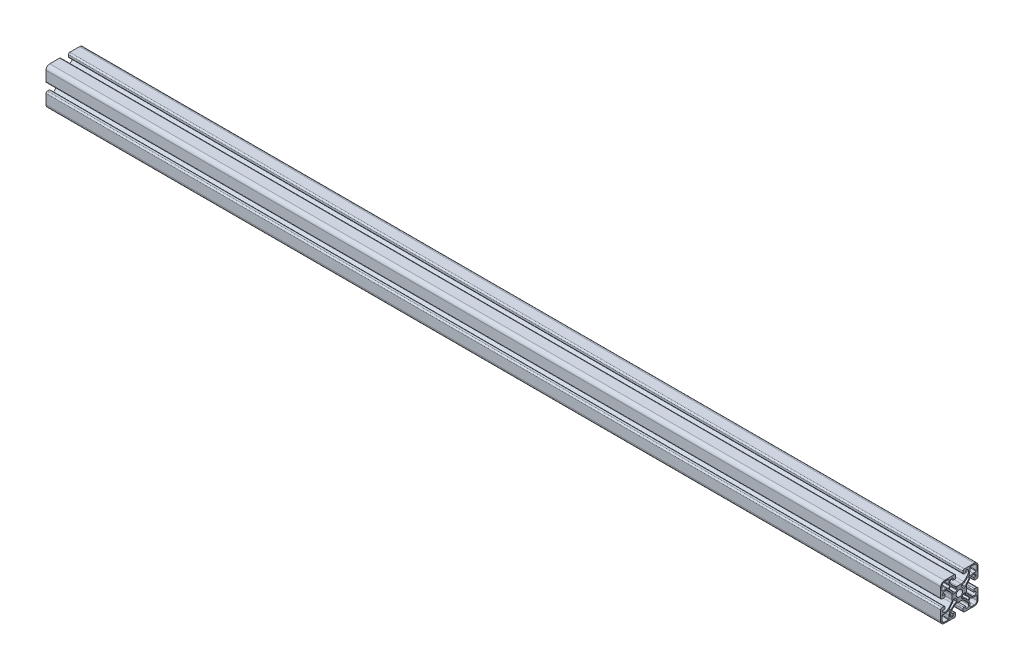
from build123d import *

# Parameters (mm, degrees)
SKETCH1_R           = 2.159
BOSS_EXTRUDE1_DEPTH = 609.6


with BuildPart() as part:
    # Sketch1 → Boss-Extrude1 (new body)
    with BuildSketch(Plane.YZ):
        with BuildLine():
            Line((0.772520695, -13.711151156), (0.772520695, -14.981151156))
            ThreePointArc((0.772520695, -14.981151156), (0.493539904, -15.654670365), (-0.179979305, -15.933651156))
            Line((-0.179979305, -15.933651156), (-6.847479304, -15.933651156))
            ThreePointArc((-6.847479304, -15.933651156), (-8.643530528, -15.18970238), (-9.387479304, -13.393651156))
            Line((-9.387479304, -13.393651156), (-9.387479304, -6.726151156))
            ThreePointArc((-9.387479304, -6.726151156), (-9.108498513, -6.052631947), (-8.434979304, -5.773651156))
            Line((-8.434979304, -5.773651156), (-7.164979304, -5.773651156))
            ThreePointArc((-7.164979304, -5.773651156), (-6.715966498, -5.95963835), (-6.529979304, -6.408651156))
            Line((-6.529979304, -6.408651156), (-6.529979304, -7.519901156))
            ThreePointArc((-6.529979304, -7.519901156), (-6.576476103, -7.632154358), (-6.688729304, -7.678651156))
            Line((-6.688729304, -7.678651156), (-7.958729304, -7.678651156))
            ThreePointArc((-7.958729304, -7.678651156), (-8.070982506, -7.725147955), (-8.117479304, -7.837401156))
            Line((-8.117479304, -7.837401156), (-8.117479304, -7.996151156))
            ThreePointArc((-8.117479304, -7.996151156), (-7.652511319, -9.118683171), (-6.529979304, -9.583651156))
            Line((-6.529979304, -9.583651156), (-6.034908058, -9.583651156))
            ThreePointArc((-6.034908058, -9.583651156), (-5.630688087, -9.517605564), (-5.268510552, -9.326338111))
            ThreePointArc((-5.268510552, -9.326338111), (-3.576591903, -7.846310071), (-2.110681684, -6.142144896))
            ThreePointArc((-2.110681684, -6.142144896), (-1.737480566, -5.424665046), (-1.608729304, -4.626241899))
            Line((-1.608729304, -4.626241899), (-1.608729304, -1.84106041))
            ThreePointArc((-1.608729304, -1.84106041), (-1.737480566, -1.042637264), (-2.110681683, -0.325157416))
            ThreePointArc((-2.110681683, -0.325157416), (-3.576591906, 1.379007761), (-5.268510559, 2.859035802))
            ThreePointArc((-5.268510559, 2.859035802), (-5.630688091, 3.050303253), (-6.034908058, 3.116348845))
            Line((-6.034908058, 3.116348845), (-6.529979305, 3.116348845))
            ThreePointArc((-6.529979305, 3.116348845), (-7.65251132, 2.65138086), (-8.117479305, 1.528848845))
            Line((-8.117479305, 1.528848845), (-8.117479305, 1.370098845))
            ThreePointArc((-8.117479305, 1.370098845), (-8.070982507, 1.257845643), (-7.958729305, 1.211348845))
            Line((-7.958729305, 1.211348845), (-6.688729305, 1.211348845))
            ThreePointArc((-6.688729305, 1.211348845), (-6.576476104, 1.164852046), (-6.529979305, 1.052598845))
            Line((-6.529979305, 1.052598845), (-6.529979305, -0.058651155))
            ThreePointArc((-6.529979305, -0.058651155), (-6.715966499, -0.507663961), (-7.164979305, -0.693651155))
            Line((-7.164979305, -0.693651155), (-8.434979305, -0.693651155))
            ThreePointArc((-8.434979305, -0.693651155), (-9.108498514, -0.414670364), (-9.387479305, 0.258848845))
            Line((-9.387479305, 0.258848845), (-9.387479305, 6.926348844))
            ThreePointArc((-9.387479305, 6.926348844), (-8.643530529, 8.722400069), (-6.847479305, 9.466348844))
            Line((-6.847479305, 9.466348844), (-0.179979306, 9.466348844))
            ThreePointArc((-0.179979306, 9.466348844), (0.493539903, 9.187368053), (0.772520694, 8.513848844))
            Line((0.772520694, 8.513848844), (0.772520694, 7.243848844))
            ThreePointArc((0.772520694, 7.243848844), (0.5865335, 6.794836038), (0.137520694, 6.608848844))
            Line((0.137520694, 6.608848844), (-0.973729306, 6.608848844))
            ThreePointArc((-0.973729306, 6.608848844), (-1.085982507, 6.655345643), (-1.132479306, 6.767598844))
            Line((-1.132479306, 6.767598844), (-1.132479306, 8.037598844))
            ThreePointArc((-1.132479306, 8.037598844), (-1.178976104, 8.149852046), (-1.291229306, 8.196348844))
            Line((-1.291229306, 8.196348844), (-1.449979306, 8.196348844))
            ThreePointArc((-1.449979306, 8.196348844), (-2.572511321, 7.73138086), (-3.037479306, 6.608848844))
            Line((-3.037479306, 6.608848844), (-3.037479306, 6.113777598))
            ThreePointArc((-3.037479306, 6.113777598), (-2.971433714, 5.709557627), (-2.780166261, 5.347380093))
            ThreePointArc((-2.780166261, 5.347380093), (-1.30013822, 3.655461444), (0.404026955, 2.189551224))
            ThreePointArc((0.404026955, 2.189551224), (1.121506805, 1.816350106), (1.919929952, 1.687598845))
            Line((1.919929952, 1.687598845), (4.705111441, 1.687598845))
            ThreePointArc((4.705111441, 1.687598845), (5.503534586, 1.816350106), (6.221014435, 2.189551223))
            ThreePointArc((6.221014435, 2.189551223), (7.925179612, 3.655461446), (9.405207653, 5.3473801))
            ThreePointArc((9.405207653, 5.3473801), (9.596475104, 5.709557631), (9.662520695, 6.113777598))
            Line((9.662520695, 6.113777598), (9.662520695, 6.608848846))
            ThreePointArc((9.662520695, 6.608848846), (9.197552711, 7.731380861), (8.075020695, 8.196348846))
            Line((8.075020695, 8.196348846), (7.916270695, 8.196348846))
            ThreePointArc((7.916270695, 8.196348846), (7.804017494, 8.149852047), (7.757520695, 8.037598846))
            Line((7.757520695, 8.037598846), (7.757520695, 6.767598846))
            ThreePointArc((7.757520695, 6.767598846), (7.711023897, 6.655345644), (7.598770695, 6.608848846))
            Line((7.598770695, 6.608848846), (6.487520696, 6.608848846))
            ThreePointArc((6.487520696, 6.608848846), (6.03850789, 6.79483604), (5.852520696, 7.243848846))
            Line((5.852520696, 7.243848846), (5.852520696, 8.513848846))
            ThreePointArc((5.852520696, 8.513848846), (6.131501487, 9.187368055), (6.805020696, 9.466348846))
            Line((6.805020696, 9.466348846), (13.472520695, 9.466348846))
            ThreePointArc((13.472520695, 9.466348846), (15.268571919, 8.72240007), (16.012520695, 6.926348846))
            Line((16.012520695, 6.926348846), (16.012520695, 0.258848846))
            ThreePointArc((16.012520695, 0.258848846), (15.733539904, -0.414670363), (15.060020695, -0.693651154))
            Line((15.060020695, -0.693651154), (13.790020695, -0.693651154))
            ThreePointArc((13.790020695, -0.693651154), (13.341007889, -0.50766396), (13.155020695, -0.058651154))
            Line((13.155020695, -0.058651154), (13.155020695, 1.052598846))
            ThreePointArc((13.155020695, 1.052598846), (13.201517494, 1.164852048), (13.313770695, 1.211348846))
            Line((13.313770695, 1.211348846), (14.583770695, 1.211348846))
            ThreePointArc((14.583770695, 1.211348846), (14.696023897, 1.257845645), (14.742520695, 1.370098846))
            Line((14.742520695, 1.370098846), (14.742520695, 1.528848846))
            ThreePointArc((14.742520695, 1.528848846), (14.27755271, 2.651380861), (13.155020695, 3.116348846))
            Line((13.155020695, 3.116348846), (12.659949449, 3.116348846))
            ThreePointArc((12.659949449, 3.116348846), (12.255729478, 3.050303254), (11.893551943, 2.859035801))
            ThreePointArc((11.893551943, 2.859035801), (10.201633294, 1.37900776), (8.735723075, -0.325157415))
            ThreePointArc((8.735723075, -0.325157415), (8.362521957, -1.042637264), (8.233770695, -1.841060411))
            Line((8.233770695, -1.841060411), (8.233770695, -4.626241901))
            ThreePointArc((8.233770695, -4.626241901), (8.362521957, -5.424665046), (8.735723074, -6.142144894))
            ThreePointArc((8.735723074, -6.142144894), (10.201633297, -7.846310072), (11.89355195, -9.326338113))
            ThreePointArc((11.89355195, -9.326338113), (12.255729482, -9.517605564), (12.659949449, -9.583651155))
            Line((12.659949449, -9.583651155), (13.155020696, -9.583651155))
            ThreePointArc((13.155020696, -9.583651155), (14.277552711, -9.11868317), (14.742520696, -7.996151155))
            Line((14.742520696, -7.996151155), (14.742520696, -7.837401155))
            ThreePointArc((14.742520696, -7.837401155), (14.696023898, -7.725147954), (14.583770696, -7.678651155))
            Line((14.583770696, -7.678651155), (13.313770696, -7.678651155))
            ThreePointArc((13.313770696, -7.678651155), (13.201517495, -7.632154357), (13.155020696, -7.519901155))
            Line((13.155020696, -7.519901155), (13.155020696, -6.408651155))
            ThreePointArc((13.155020696, -6.408651155), (13.34100789, -5.959638349), (13.790020696, -5.773651155))
            Line((13.790020696, -5.773651155), (15.060020696, -5.773651155))
            ThreePointArc((15.060020696, -5.773651155), (15.733539905, -6.052631946), (16.012520696, -6.726151155))
            Line((16.012520696, -6.726151155), (16.012520696, -13.393651155))
            ThreePointArc((16.012520696, -13.393651155), (15.26857192, -15.189702379), (13.472520696, -15.933651155))
            Line((13.472520696, -15.933651155), (6.805020697, -15.933651155))
            ThreePointArc((6.805020697, -15.933651155), (6.131501488, -15.654670364), (5.852520697, -14.981151155))
            Line((5.852520697, -14.981151155), (5.852520697, -13.711151155))
            ThreePointArc((5.852520697, -13.711151155), (6.038507891, -13.262138349), (6.487520697, -13.076151155))
            Line((6.487520697, -13.076151155), (7.598770697, -13.076151155))
            ThreePointArc((7.598770697, -13.076151155), (7.711023898, -13.122647953), (7.757520697, -13.234901155))
            Line((7.757520697, -13.234901155), (7.757520697, -14.504901155))
            ThreePointArc((7.757520697, -14.504901155), (7.804017495, -14.617154356), (7.916270697, -14.663651155))
            Line((7.916270697, -14.663651155), (8.075020697, -14.663651155))
            ThreePointArc((8.075020697, -14.663651155), (9.197552712, -14.19868317), (9.662520697, -13.076151155))
            Line((9.662520697, -13.076151155), (9.662520697, -12.581079908))
            ThreePointArc((9.662520697, -12.581079908), (9.596475104, -12.176859938), (9.405207651, -11.814682403))
            ThreePointArc((9.405207651, -11.814682403), (7.925179611, -10.122763754), (6.221014436, -8.656853534))
            ThreePointArc((6.221014436, -8.656853534), (5.503534586, -8.283652417), (4.705111439, -8.154901155))
            Line((4.705111439, -8.154901155), (1.91992995, -8.154901155))
            ThreePointArc((1.91992995, -8.154901155), (1.121506805, -8.283652417), (0.404026956, -8.656853534))
            ThreePointArc((0.404026956, -8.656853534), (-1.300138221, -10.122763756), (-2.780166262, -11.81468241))
            ThreePointArc((-2.780166262, -11.81468241), (-2.971433713, -12.176859941), (-3.037479304, -12.581079908))
            Line((-3.037479304, -12.581079908), (-3.037479304, -13.076151156))
            ThreePointArc((-3.037479304, -13.076151156), (-2.57251132, -14.198683171), (-1.449979305, -14.663651156))
            Line((-1.449979305, -14.663651156), (-1.291229305, -14.663651156))
            ThreePointArc((-1.291229305, -14.663651156), (-1.178976103, -14.617154357), (-1.132479305, -14.504901156))
            Line((-1.132479305, -14.504901156), (-1.132479305, -13.234901156))
            ThreePointArc((-1.132479305, -13.234901156), (-1.085982506, -13.122647954), (-0.973729305, -13.076151156))
            Line((-0.973729305, -13.076151156), (0.137520695, -13.076151156))
            ThreePointArc((0.137520695, -13.076151156), (0.586533501, -13.26213835), (0.772520695, -13.711151156))
        make_face()
        with Locations((3.312520697, -3.233651155)):
            Circle(SKETCH1_R, mode=Mode.SUBTRACT)
        with BuildLine():
            Line((9.84481504, 4.637844283), (10.012608151, 4.8557916))
            ThreePointArc((10.012608151, 4.8557916), (10.318636081, 5.435275655), (10.42430903, 6.082027611))
            Line((10.42430903, 6.082027611), (10.42430903, 8.386848856))
            ThreePointArc((10.42430903, 8.386848856), (10.517302627, 8.611355259), (10.74180903, 8.704348856))
            Line((10.74180903, 8.704348856), (13.472309014, 8.704348856))
            ThreePointArc((13.472309014, 8.704348856), (14.729544877, 8.183584711), (15.250309023, 6.926348847))
            Line((15.250309023, 6.926348847), (15.250309023, 4.19584885))
            ThreePointArc((15.250309023, 4.19584885), (15.157315426, 3.971342447), (14.932809023, 3.87834885))
            Line((14.932809023, 3.87834885), (12.627987776, 3.87834885))
            ThreePointArc((12.627987776, 3.87834885), (11.981235825, 3.772675903), (11.401751773, 3.466647978))
            Line((11.401751773, 3.466647978), (11.183804456, 3.298854867))
            ThreePointArc((11.183804456, 3.298854867), (10.968844184, 3.23190561), (10.763539377, 3.324318043))
            Line((10.763539377, 3.324318043), (9.870278216, 4.217579204))
            ThreePointArc((9.870278216, 4.217579204), (9.777865783, 4.422884011), (9.84481504, 4.637844283))
        make_face(mode=Mode.SUBTRACT)
        with BuildLine():
            Line((-4.558974742, 3.298643188), (-4.776922058, 3.466436299))
            ThreePointArc((-4.776922058, 3.466436299), (-5.35640611, 3.772464224), (-6.003158061, 3.878137171))
            Line((-6.003158061, 3.878137171), (-8.307979315, 3.878137171))
            ThreePointArc((-8.307979315, 3.878137171), (-8.532485718, 3.971130768), (-8.625479315, 4.195637171))
            Line((-8.625479315, 4.195637171), (-8.625479315, 6.926137161))
            ThreePointArc((-8.625479315, 6.926137161), (-8.104715169, 8.183373025), (-6.847479306, 8.704137171))
            Line((-6.847479306, 8.704137171), (-4.116979309, 8.704137171))
            ThreePointArc((-4.116979309, 8.704137171), (-3.892472906, 8.611143574), (-3.799479309, 8.386637171))
            Line((-3.799479309, 8.386637171), (-3.799479309, 6.081815924))
            ThreePointArc((-3.799479309, 6.081815924), (-3.693806362, 5.435063973), (-3.387778437, 4.85557992))
            Line((-3.387778437, 4.85557992), (-3.219985326, 4.637632604))
            ThreePointArc((-3.219985326, 4.637632604), (-3.153036069, 4.422672332), (-3.245448502, 4.217367525))
            Line((-3.245448502, 4.217367525), (-4.138709663, 3.324106364))
            ThreePointArc((-4.138709663, 3.324106364), (-4.34401447, 3.231693931), (-4.558974742, 3.298643188))
        make_face(mode=Mode.SUBTRACT)
        with BuildLine():
            Line((4.900020697, -0.306445792), (4.900020697, 0.638730742))
            ThreePointArc((4.900020697, 0.638730742), (4.978885643, 0.848157487), (5.176301398, 0.953543734))
            ThreePointArc((5.176301398, 0.953543734), (5.993365908, 1.169605569), (6.728820708, 1.585998853))
            ThreePointArc((6.728820708, 1.585998853), (7.886169011, 2.538405301), (8.953104421, 3.591107524))
            ThreePointArc((8.953104421, 3.591107524), (9.179965542, 3.692814602), (9.41055899, 3.599879359))
            Line((9.41055899, 3.599879359), (10.146051215, 2.864387135))
            ThreePointArc((10.146051215, 2.864387135), (10.238986457, 2.633793689), (10.137279379, 2.406932571))
            ThreePointArc((10.137279379, 2.406932571), (9.084577143, 1.339997151), (8.132170687, 0.182648832))
            ThreePointArc((8.132170687, 0.182648832), (7.715777415, -0.552805957), (7.499715586, -1.369870454))
            ThreePointArc((7.499715586, -1.369870454), (7.39432934, -1.567286209), (7.184902595, -1.646151156))
            Line((7.184902595, -1.646151156), (6.23972607, -1.646151156))
            ThreePointArc((6.23972607, -1.646151156), (6.08836388, -1.607749235), (5.973616485, -1.501832971))
            ThreePointArc((5.973616485, -1.501832971), (5.557584726, -0.98858712), (5.044338875, -0.572555363))
            ThreePointArc((5.044338875, -0.572555363), (4.938422615, -0.457807974), (4.900020697, -0.306445792))
        make_face(mode=Mode.SUBTRACT)
        with BuildLine():
            Line((0.385315334, -1.646151156), (-0.559861201, -1.646151156))
            ThreePointArc((-0.559861201, -1.646151156), (-0.769287945, -1.567286209), (-0.874674192, -1.369870455))
            ThreePointArc((-0.874674192, -1.369870455), (-1.090736028, -0.552805945), (-1.507129311, 0.182648856))
            ThreePointArc((-1.507129311, 0.182648856), (-2.459535759, 1.339997159), (-3.512237982, 2.406932568))
            ThreePointArc((-3.512237982, 2.406932568), (-3.61394506, 2.633793689), (-3.521009818, 2.864387138))
            Line((-3.521009818, 2.864387138), (-2.785517593, 3.599879363))
            ThreePointArc((-2.785517593, 3.599879363), (-2.554924147, 3.692814604), (-2.328063029, 3.591107527))
            ThreePointArc((-2.328063029, 3.591107527), (-1.26112761, 2.538405291), (-0.103779291, 1.585998835))
            ThreePointArc((-0.103779291, 1.585998835), (0.631675499, 1.169605562), (1.448739995, 0.953543734))
            ThreePointArc((1.448739995, 0.953543734), (1.64615575, 0.848157487), (1.725020697, 0.638730743))
            Line((1.725020697, 0.638730743), (1.725020697, -0.306445783))
            ThreePointArc((1.725020697, -0.306445783), (1.686618777, -0.457807972), (1.580702512, -0.572555367))
            ThreePointArc((1.580702512, -0.572555367), (1.067456662, -0.988587126), (0.651424905, -1.501832978))
            ThreePointArc((0.651424905, -1.501832978), (0.536677515, -1.607749237), (0.385315334, -1.646151156))
        make_face(mode=Mode.SUBTRACT)
        with BuildLine():
            Line((-3.219773646, -11.105146594), (-3.387566758, -11.32309391))
            ThreePointArc((-3.387566758, -11.32309391), (-3.693594682, -11.902577963), (-3.79926763, -12.549329913))
            Line((-3.79926763, -12.549329913), (-3.79926763, -14.854151161))
            ThreePointArc((-3.79926763, -14.854151161), (-3.892261226, -15.078657564), (-4.116767629, -15.171651161))
            Line((-4.116767629, -15.171651161), (-6.847267613, -15.171651161))
            ThreePointArc((-6.847267613, -15.171651161), (-8.104503477, -14.650887015), (-8.625267623, -13.393651152))
            Line((-8.625267623, -13.393651152), (-8.625267623, -10.663151161))
            ThreePointArc((-8.625267623, -10.663151161), (-8.532274026, -10.438644758), (-8.307767623, -10.345651161))
            Line((-8.307767623, -10.345651161), (-6.002946382, -10.345651161))
            ThreePointArc((-6.002946382, -10.345651161), (-5.356194431, -10.239978214), (-4.776710379, -9.933950289))
            Line((-4.776710379, -9.933950289), (-4.558763062, -9.766157178))
            ThreePointArc((-4.558763062, -9.766157178), (-4.34380279, -9.699207921), (-4.138497984, -9.791620354))
            Line((-4.138497984, -9.791620354), (-3.245236822, -10.684881515))
            ThreePointArc((-3.245236822, -10.684881515), (-3.152824389, -10.890186322), (-3.219773646, -11.105146594))
        make_face(mode=Mode.SUBTRACT)
        with BuildLine():
            Line((11.184016136, -9.765945499), (11.401963452, -9.93373861))
            ThreePointArc((11.401963452, -9.93373861), (11.981447504, -10.239766535), (12.628199455, -10.345439482))
            Line((12.628199455, -10.345439482), (14.933020703, -10.345439482))
            ThreePointArc((14.933020703, -10.345439482), (15.157527106, -10.438433079), (15.250520703, -10.662939482))
            Line((15.250520703, -10.662939482), (15.250520703, -13.393439466))
            ThreePointArc((15.250520703, -13.393439466), (14.729756557, -14.650675329), (13.472520693, -15.171439475))
            Line((13.472520693, -15.171439475), (10.742020697, -15.171439475))
            ThreePointArc((10.742020697, -15.171439475), (10.517514293, -15.078445878), (10.424520697, -14.853939475))
            Line((10.424520697, -14.853939475), (10.424520697, -12.549118226))
            ThreePointArc((10.424520697, -12.549118226), (10.318847751, -11.90236628), (10.012819831, -11.322882231))
            Line((10.012819831, -11.322882231), (9.84502672, -11.104934915))
            ThreePointArc((9.84502672, -11.104934915), (9.778077463, -10.889974643), (9.870489896, -10.684669836))
            Line((9.870489896, -10.684669836), (10.763751057, -9.791408675))
            ThreePointArc((10.763751057, -9.791408675), (10.969055864, -9.698996242), (11.184016136, -9.765945499))
        make_face(mode=Mode.SUBTRACT)
        with BuildLine():
            Line((1.725020697, -6.160856519), (1.725020697, -7.106033053))
            ThreePointArc((1.725020697, -7.106033053), (1.646155751, -7.315459798), (1.448739996, -7.420846044))
            ThreePointArc((1.448739996, -7.420846044), (0.631675486, -7.63690788), (-0.103779314, -8.053301163))
            ThreePointArc((-0.103779314, -8.053301163), (-1.261127617, -9.005707612), (-2.328063027, -10.058409834))
            ThreePointArc((-2.328063027, -10.058409834), (-2.554924148, -10.160116913), (-2.785517596, -10.06718167))
            Line((-2.785517596, -10.06718167), (-3.521009821, -9.331689445))
            ThreePointArc((-3.521009821, -9.331689445), (-3.613945063, -9.101096), (-3.512237985, -8.874234882))
            ThreePointArc((-3.512237985, -8.874234882), (-2.459535749, -7.807299462), (-1.507129293, -6.649951143))
            ThreePointArc((-1.507129293, -6.649951143), (-1.090736021, -5.914496353), (-0.874674192, -5.097431857))
            ThreePointArc((-0.874674192, -5.097431857), (-0.769287946, -4.900016102), (-0.559861201, -4.821151155))
            Line((-0.559861201, -4.821151155), (0.385315324, -4.821151155))
            ThreePointArc((0.385315324, -4.821151155), (0.536677514, -4.859553075), (0.651424909, -4.96546934))
            ThreePointArc((0.651424909, -4.96546934), (1.067456668, -5.478715191), (1.580702519, -5.894746948))
            ThreePointArc((1.580702519, -5.894746948), (1.686618779, -6.009494337), (1.725020697, -6.160856519))
        make_face(mode=Mode.SUBTRACT)
        with BuildLine():
            Line((6.23972606, -4.821151155), (7.184902595, -4.821151155))
            ThreePointArc((7.184902595, -4.821151155), (7.394329339, -4.900016102), (7.499715586, -5.097431856))
            ThreePointArc((7.499715586, -5.097431856), (7.715777422, -5.914496366), (8.132170705, -6.649951166))
            ThreePointArc((8.132170705, -6.649951166), (9.084577153, -7.80729947), (10.137279376, -8.874234879))
            ThreePointArc((10.137279376, -8.874234879), (10.238986455, -9.101096), (10.146051212, -9.331689449))
            Line((10.146051212, -9.331689449), (9.410558987, -10.067181674))
            ThreePointArc((9.410558987, -10.067181674), (9.179965541, -10.160116915), (8.953104423, -10.058409837))
            ThreePointArc((8.953104423, -10.058409837), (7.886169003, -9.005707601), (6.728820685, -8.053301146))
            ThreePointArc((6.728820685, -8.053301146), (5.993365895, -7.636907873), (5.176301399, -7.420846045))
            ThreePointArc((5.176301399, -7.420846045), (4.978885644, -7.315459798), (4.900020697, -7.106033054))
            Line((4.900020697, -7.106033054), (4.900020697, -6.160856528))
            ThreePointArc((4.900020697, -6.160856528), (4.938422617, -6.009494339), (5.044338882, -5.894746943))
            ThreePointArc((5.044338882, -5.894746943), (5.557584732, -5.478715185), (5.973616489, -4.965469333))
            ThreePointArc((5.973616489, -4.965469333), (6.088363879, -4.859553074), (6.23972606, -4.821151155))
        make_face(mode=Mode.SUBTRACT)
    extrude(amount=BOSS_EXTRUDE1_DEPTH)


solid = part.part
